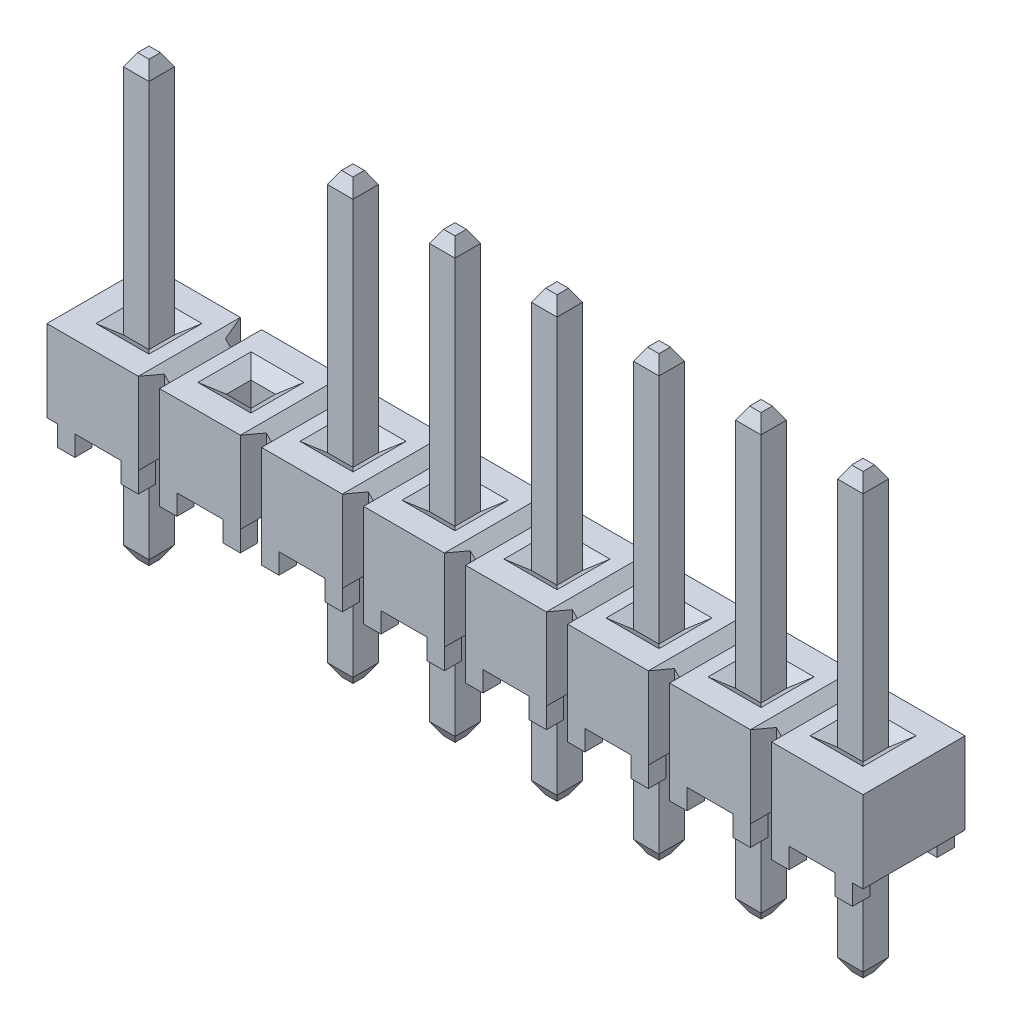
from build123d import *
from OCP.BRepFilletAPI import BRepFilletAPI_MakeChamfer

# Parameters (mm, degrees)
MAIN_BODY_DEPTH                          = 1.27
SKETCH4_W                                = 0.508
SKETCH4_H                                = 1.6764
BASE_CUT_DEPTH                           = 2.54
MAIN_BODY_PATTERN_COUNT                  = 8
MAIN_BODY_PATTERN_PITCH                  = 2.54
SKETCH19_W                               = 0.6096
SKETCH19_H                               = 0.6096
PIN_CUT_DEPTH                            = 19.005357536
PIN_CHAMFER_SIZE                         = 0.254
PIN_CHAMFER_SIZE2                        = 0.3556
PIN_PATTERN_COUNT                        = 8
PIN_PATTERN_PITCH                        = 2.54
PIN_CHAMFER_OF_PIN_PATTERN_SIZE          = 0.254
PIN_CHAMFER_OF_PIN_PATTERN_SIZE2         = 0.3556
SLOT_CUT_1_DEPTH                         = 19.005357536
SLOT_CUT_2_DEPTH                         = 2.54
SLOT_PATTERN_COUNT                       = 7
SLOT_PATTERN_PITCH                       = 2.54
SKETCH9_W                                = 0.635
SKETCH9_H                                = 10.922
STRAIGHT_LEAD_DEPTH                      = 0.3175
LEAD_CHAMFER_SIZE                        = 0.17526
LEAD_CHAMFER_SIZE2                       = 0.3048
STRAIGHT_L_PATTERN_COUNT                 = 8
STRAIGHT_L_PATTERN_PITCH                 = 2.54
LEAD_CHAMFER_OF_STRAIGHT_L_PATTERN_SIZE  = 0.17526
LEAD_CHAMFER_OF_STRAIGHT_L_PATTERN_SIZE2 = 0.3048


with BuildPart() as part:
    # Sketch3 → Main Body (new, symmetric)
    with BuildSketch(Plane.XY):
        Polygon((0, 0.508), (0.26416, 0.508), (0.26416, 0), (0.69596, 0), (0.69596, 0.508), (1.84404, 0.508), (1.84404, 0), (2.27584, 0), (2.27584, 0.508), (2.54, 0.508), (2.54, 2.54), (0, 2.54), align=None)
    main_body = extrude(amount=MAIN_BODY_DEPTH, both=True)

    # Sketch4 → Base Cut (cut)
    with BuildSketch(Plane(origin=(2.54, 2.54, 0), x_dir=(0, -1, 0), z_dir=(-1, 0, 0))):
        with Locations((2.286, 0)):
            Rectangle(SKETCH4_W, SKETCH4_H)
    base_cut = extrude(amount=BASE_CUT_DEPTH, mode=Mode.SUBTRACT)

    # Main Body Pattern: Main Body, Base Cut ×8
    with Locations(*[(-i * MAIN_BODY_PATTERN_PITCH, 0, 0) for i in range(1, MAIN_BODY_PATTERN_COUNT)]):
        add(main_body)
        add(base_cut, mode=Mode.SUBTRACT)

    # Sketch19 → Pin Cut (cut, through all)
    with BuildSketch(Plane(origin=(0, 2.54, 0), x_dir=(-1, 0, 0), z_dir=(0, 1, 0))):
        with Locations((-1.27, 0)):
            Rectangle(SKETCH19_W, SKETCH19_H)
    pin_cut = extrude(amount=-PIN_CUT_DEPTH, mode=Mode.SUBTRACT)

    # Pin Chamfer: one chamfer whose edges measure the first distance from different faces: ONE call of the kernel's chamfer builder (chamfer() names one face for all edges)
    pin_chamfer_edges_1 = [part.edges().sort_by_distance(p)[0] for p in [
        (1.27, 0.508, -0.3048),
        (1.27, 2.54, -0.3048),
    ]]
    pin_chamfer_side_1 = [part.faces().sort_by_distance(p)[0] for p in [
        (1.27, 1.524, -0.3048),
    ]]
    pin_chamfer_edges_2 = [part.edges().sort_by_distance(p)[0] for p in [
        (0.9652, 0.508, 0),
        (0.9652, 2.54, 0),
    ]]
    pin_chamfer_side_2 = [part.faces().sort_by_distance(p)[0] for p in [
        (0.9652, 1.524, 0),
    ]]
    pin_chamfer_edges_3 = [part.edges().sort_by_distance(p)[0] for p in [
        (1.27, 0.508, 0.3048),
        (1.27, 2.54, 0.3048),
    ]]
    pin_chamfer_side_3 = [part.faces().sort_by_distance(p)[0] for p in [
        (1.27, 1.524, 0.3048),
    ]]
    pin_chamfer_edges_4 = [part.edges().sort_by_distance(p)[0] for p in [
        (1.5748, 0.508, 0),
        (1.5748, 2.54, 0),
    ]]
    pin_chamfer_side_4 = [part.faces().sort_by_distance(p)[0] for p in [
        (1.5748, 1.524, 0),
    ]]
    pin_chamfer = BRepFilletAPI_MakeChamfer(part.part.solid().wrapped)
    for e in pin_chamfer_edges_1:
        pin_chamfer.Add(PIN_CHAMFER_SIZE, PIN_CHAMFER_SIZE2, e.wrapped, pin_chamfer_side_1[0].wrapped)  # the first distance lies on this face
    for e in pin_chamfer_edges_2:
        pin_chamfer.Add(PIN_CHAMFER_SIZE, PIN_CHAMFER_SIZE2, e.wrapped, pin_chamfer_side_2[0].wrapped)  # the first distance lies on this face
    for e in pin_chamfer_edges_3:
        pin_chamfer.Add(PIN_CHAMFER_SIZE, PIN_CHAMFER_SIZE2, e.wrapped, pin_chamfer_side_3[0].wrapped)  # the first distance lies on this face
    for e in pin_chamfer_edges_4:
        pin_chamfer.Add(PIN_CHAMFER_SIZE, PIN_CHAMFER_SIZE2, e.wrapped, pin_chamfer_side_4[0].wrapped)  # the first distance lies on this face
    add(Compound.cast(pin_chamfer.Shape()), mode=Mode.REPLACE)

    # Pin Pattern: Pin Cut ×8
    with Locations(*[(-i * PIN_PATTERN_PITCH, 0, 0) for i in range(1, PIN_PATTERN_COUNT)]):
        add(pin_cut, mode=Mode.SUBTRACT)

    # Pin Chamfer of Pin Pattern: one chamfer whose edges measure the first distance from different faces: ONE call of the kernel's chamfer builder (chamfer() names one face for all edges)
    pin_chamfer_of_pin_pattern_edges_1 = [part.edges().sort_by_distance(p)[0] for p in [
        (-1.27, 0.508, -0.3048),
        (-1.27, 2.54, -0.3048),
    ]]
    pin_chamfer_of_pin_pattern_side_1 = [part.faces().sort_by_distance(p)[0] for p in [
        (-1.27, 1.524, -0.3048),
    ]]
    pin_chamfer_of_pin_pattern_edges_2 = [part.edges().sort_by_distance(p)[0] for p in [
        (-1.5748, 0.508, 0),
        (-1.5748, 2.54, 0),
    ]]
    pin_chamfer_of_pin_pattern_side_2 = [part.faces().sort_by_distance(p)[0] for p in [
        (-1.5748, 1.524, 0),
    ]]
    pin_chamfer_of_pin_pattern_edges_3 = [part.edges().sort_by_distance(p)[0] for p in [
        (-1.27, 0.508, 0.3048),
        (-1.27, 2.54, 0.3048),
    ]]
    pin_chamfer_of_pin_pattern_side_3 = [part.faces().sort_by_distance(p)[0] for p in [
        (-1.27, 1.524, 0.3048),
    ]]
    pin_chamfer_of_pin_pattern_edges_4 = [part.edges().sort_by_distance(p)[0] for p in [
        (-0.9652, 0.508, 0),
        (-0.9652, 2.54, 0),
    ]]
    pin_chamfer_of_pin_pattern_side_4 = [part.faces().sort_by_distance(p)[0] for p in [
        (-0.9652, 1.524, 0),
    ]]
    pin_chamfer_of_pin_pattern_edges_5 = [part.edges().sort_by_distance(p)[0] for p in [
        (-3.81, 0.508, -0.3048),
        (-3.81, 2.54, -0.3048),
    ]]
    pin_chamfer_of_pin_pattern_side_5 = [part.faces().sort_by_distance(p)[0] for p in [
        (-3.81, 1.524, -0.3048),
    ]]
    pin_chamfer_of_pin_pattern_edges_6 = [part.edges().sort_by_distance(p)[0] for p in [
        (-4.1148, 0.508, 0),
        (-4.1148, 2.54, 0),
    ]]
    pin_chamfer_of_pin_pattern_side_6 = [part.faces().sort_by_distance(p)[0] for p in [
        (-4.1148, 1.524, 0),
    ]]
    pin_chamfer_of_pin_pattern_edges_7 = [part.edges().sort_by_distance(p)[0] for p in [
        (-3.81, 0.508, 0.3048),
        (-3.81, 2.54, 0.3048),
    ]]
    pin_chamfer_of_pin_pattern_side_7 = [part.faces().sort_by_distance(p)[0] for p in [
        (-3.81, 1.524, 0.3048),
    ]]
    pin_chamfer_of_pin_pattern_edges_8 = [part.edges().sort_by_distance(p)[0] for p in [
        (-3.5052, 0.508, 0),
        (-3.5052, 2.54, 0),
    ]]
    pin_chamfer_of_pin_pattern_side_8 = [part.faces().sort_by_distance(p)[0] for p in [
        (-3.5052, 1.524, 0),
    ]]
    pin_chamfer_of_pin_pattern_edges_9 = [part.edges().sort_by_distance(p)[0] for p in [
        (-6.35, 0.508, -0.3048),
        (-6.35, 2.54, -0.3048),
    ]]
    pin_chamfer_of_pin_pattern_side_9 = [part.faces().sort_by_distance(p)[0] for p in [
        (-6.35, 1.524, -0.3048),
    ]]
    pin_chamfer_of_pin_pattern_edges_10 = [part.edges().sort_by_distance(p)[0] for p in [
        (-6.6548, 0.508, 0),
        (-6.6548, 2.54, 0),
    ]]
    pin_chamfer_of_pin_pattern_side_10 = [part.faces().sort_by_distance(p)[0] for p in [
        (-6.6548, 1.524, 0),
    ]]
    pin_chamfer_of_pin_pattern_edges_11 = [part.edges().sort_by_distance(p)[0] for p in [
        (-6.35, 0.508, 0.3048),
        (-6.35, 2.54, 0.3048),
    ]]
    pin_chamfer_of_pin_pattern_side_11 = [part.faces().sort_by_distance(p)[0] for p in [
        (-6.35, 1.524, 0.3048),
    ]]
    pin_chamfer_of_pin_pattern_edges_12 = [part.edges().sort_by_distance(p)[0] for p in [
        (-6.0452, 0.508, 0),
        (-6.0452, 2.54, 0),
    ]]
    pin_chamfer_of_pin_pattern_side_12 = [part.faces().sort_by_distance(p)[0] for p in [
        (-6.0452, 1.524, 0),
    ]]
    pin_chamfer_of_pin_pattern_edges_13 = [part.edges().sort_by_distance(p)[0] for p in [
        (-8.89, 0.508, -0.3048),
        (-8.89, 2.54, -0.3048),
    ]]
    pin_chamfer_of_pin_pattern_side_13 = [part.faces().sort_by_distance(p)[0] for p in [
        (-8.89, 1.524, -0.3048),
    ]]
    pin_chamfer_of_pin_pattern_edges_14 = [part.edges().sort_by_distance(p)[0] for p in [
        (-9.1948, 0.508, 0),
        (-9.1948, 2.54, 0),
    ]]
    pin_chamfer_of_pin_pattern_side_14 = [part.faces().sort_by_distance(p)[0] for p in [
        (-9.1948, 1.524, 0),
    ]]
    pin_chamfer_of_pin_pattern_edges_15 = [part.edges().sort_by_distance(p)[0] for p in [
        (-8.89, 0.508, 0.3048),
        (-8.89, 2.54, 0.3048),
    ]]
    pin_chamfer_of_pin_pattern_side_15 = [part.faces().sort_by_distance(p)[0] for p in [
        (-8.89, 1.524, 0.3048),
    ]]
    pin_chamfer_of_pin_pattern_edges_16 = [part.edges().sort_by_distance(p)[0] for p in [
        (-8.5852, 0.508, 0),
        (-8.5852, 2.54, 0),
    ]]
    pin_chamfer_of_pin_pattern_side_16 = [part.faces().sort_by_distance(p)[0] for p in [
        (-8.5852, 1.524, 0),
    ]]
    pin_chamfer_of_pin_pattern_edges_17 = [part.edges().sort_by_distance(p)[0] for p in [
        (-11.43, 0.508, -0.3048),
        (-11.43, 2.54, -0.3048),
    ]]
    pin_chamfer_of_pin_pattern_side_17 = [part.faces().sort_by_distance(p)[0] for p in [
        (-11.43, 1.524, -0.3048),
    ]]
    pin_chamfer_of_pin_pattern_edges_18 = [part.edges().sort_by_distance(p)[0] for p in [
        (-11.7348, 0.508, 0),
        (-11.7348, 2.54, 0),
    ]]
    pin_chamfer_of_pin_pattern_side_18 = [part.faces().sort_by_distance(p)[0] for p in [
        (-11.7348, 1.524, 0),
    ]]
    pin_chamfer_of_pin_pattern_edges_19 = [part.edges().sort_by_distance(p)[0] for p in [
        (-11.43, 0.508, 0.3048),
        (-11.43, 2.54, 0.3048),
    ]]
    pin_chamfer_of_pin_pattern_side_19 = [part.faces().sort_by_distance(p)[0] for p in [
        (-11.43, 1.524, 0.3048),
    ]]
    pin_chamfer_of_pin_pattern_edges_20 = [part.edges().sort_by_distance(p)[0] for p in [
        (-11.1252, 0.508, 0),
        (-11.1252, 2.54, 0),
    ]]
    pin_chamfer_of_pin_pattern_side_20 = [part.faces().sort_by_distance(p)[0] for p in [
        (-11.1252, 1.524, 0),
    ]]
    pin_chamfer_of_pin_pattern_edges_21 = [part.edges().sort_by_distance(p)[0] for p in [
        (-13.97, 0.508, -0.3048),
        (-13.97, 2.54, -0.3048),
    ]]
    pin_chamfer_of_pin_pattern_side_21 = [part.faces().sort_by_distance(p)[0] for p in [
        (-13.97, 1.524, -0.3048),
    ]]
    pin_chamfer_of_pin_pattern_edges_22 = [part.edges().sort_by_distance(p)[0] for p in [
        (-14.2748, 0.508, 0),
        (-14.2748, 2.54, 0),
    ]]
    pin_chamfer_of_pin_pattern_side_22 = [part.faces().sort_by_distance(p)[0] for p in [
        (-14.2748, 1.524, 0),
    ]]
    pin_chamfer_of_pin_pattern_edges_23 = [part.edges().sort_by_distance(p)[0] for p in [
        (-13.97, 0.508, 0.3048),
        (-13.97, 2.54, 0.3048),
    ]]
    pin_chamfer_of_pin_pattern_side_23 = [part.faces().sort_by_distance(p)[0] for p in [
        (-13.97, 1.524, 0.3048),
    ]]
    pin_chamfer_of_pin_pattern_edges_24 = [part.edges().sort_by_distance(p)[0] for p in [
        (-13.6652, 0.508, 0),
        (-13.6652, 2.54, 0),
    ]]
    pin_chamfer_of_pin_pattern_side_24 = [part.faces().sort_by_distance(p)[0] for p in [
        (-13.6652, 1.524, 0),
    ]]
    pin_chamfer_of_pin_pattern_edges_25 = [part.edges().sort_by_distance(p)[0] for p in [
        (-16.51, 0.508, -0.3048),
        (-16.51, 2.54, -0.3048),
    ]]
    pin_chamfer_of_pin_pattern_side_25 = [part.faces().sort_by_distance(p)[0] for p in [
        (-16.51, 1.524, -0.3048),
    ]]
    pin_chamfer_of_pin_pattern_edges_26 = [part.edges().sort_by_distance(p)[0] for p in [
        (-16.8148, 0.508, 0),
        (-16.8148, 2.54, 0),
    ]]
    pin_chamfer_of_pin_pattern_side_26 = [part.faces().sort_by_distance(p)[0] for p in [
        (-16.8148, 1.524, 0),
    ]]
    pin_chamfer_of_pin_pattern_edges_27 = [part.edges().sort_by_distance(p)[0] for p in [
        (-16.51, 0.508, 0.3048),
        (-16.51, 2.54, 0.3048),
    ]]
    pin_chamfer_of_pin_pattern_side_27 = [part.faces().sort_by_distance(p)[0] for p in [
        (-16.51, 1.524, 0.3048),
    ]]
    pin_chamfer_of_pin_pattern_edges_28 = [part.edges().sort_by_distance(p)[0] for p in [
        (-16.2052, 0.508, 0),
        (-16.2052, 2.54, 0),
    ]]
    pin_chamfer_of_pin_pattern_side_28 = [part.faces().sort_by_distance(p)[0] for p in [
        (-16.2052, 1.524, 0),
    ]]
    pin_chamfer_of_pin_pattern = BRepFilletAPI_MakeChamfer(part.part.solid().wrapped)
    for e in pin_chamfer_of_pin_pattern_edges_1:
        pin_chamfer_of_pin_pattern.Add(PIN_CHAMFER_OF_PIN_PATTERN_SIZE, PIN_CHAMFER_OF_PIN_PATTERN_SIZE2, e.wrapped, pin_chamfer_of_pin_pattern_side_1[0].wrapped)  # the first distance lies on this face
    for e in pin_chamfer_of_pin_pattern_edges_2:
        pin_chamfer_of_pin_pattern.Add(PIN_CHAMFER_OF_PIN_PATTERN_SIZE, PIN_CHAMFER_OF_PIN_PATTERN_SIZE2, e.wrapped, pin_chamfer_of_pin_pattern_side_2[0].wrapped)  # the first distance lies on this face
    for e in pin_chamfer_of_pin_pattern_edges_3:
        pin_chamfer_of_pin_pattern.Add(PIN_CHAMFER_OF_PIN_PATTERN_SIZE, PIN_CHAMFER_OF_PIN_PATTERN_SIZE2, e.wrapped, pin_chamfer_of_pin_pattern_side_3[0].wrapped)  # the first distance lies on this face
    for e in pin_chamfer_of_pin_pattern_edges_4:
        pin_chamfer_of_pin_pattern.Add(PIN_CHAMFER_OF_PIN_PATTERN_SIZE, PIN_CHAMFER_OF_PIN_PATTERN_SIZE2, e.wrapped, pin_chamfer_of_pin_pattern_side_4[0].wrapped)  # the first distance lies on this face
    for e in pin_chamfer_of_pin_pattern_edges_5:
        pin_chamfer_of_pin_pattern.Add(PIN_CHAMFER_OF_PIN_PATTERN_SIZE, PIN_CHAMFER_OF_PIN_PATTERN_SIZE2, e.wrapped, pin_chamfer_of_pin_pattern_side_5[0].wrapped)  # the first distance lies on this face
    for e in pin_chamfer_of_pin_pattern_edges_6:
        pin_chamfer_of_pin_pattern.Add(PIN_CHAMFER_OF_PIN_PATTERN_SIZE, PIN_CHAMFER_OF_PIN_PATTERN_SIZE2, e.wrapped, pin_chamfer_of_pin_pattern_side_6[0].wrapped)  # the first distance lies on this face
    for e in pin_chamfer_of_pin_pattern_edges_7:
        pin_chamfer_of_pin_pattern.Add(PIN_CHAMFER_OF_PIN_PATTERN_SIZE, PIN_CHAMFER_OF_PIN_PATTERN_SIZE2, e.wrapped, pin_chamfer_of_pin_pattern_side_7[0].wrapped)  # the first distance lies on this face
    for e in pin_chamfer_of_pin_pattern_edges_8:
        pin_chamfer_of_pin_pattern.Add(PIN_CHAMFER_OF_PIN_PATTERN_SIZE, PIN_CHAMFER_OF_PIN_PATTERN_SIZE2, e.wrapped, pin_chamfer_of_pin_pattern_side_8[0].wrapped)  # the first distance lies on this face
    for e in pin_chamfer_of_pin_pattern_edges_9:
        pin_chamfer_of_pin_pattern.Add(PIN_CHAMFER_OF_PIN_PATTERN_SIZE, PIN_CHAMFER_OF_PIN_PATTERN_SIZE2, e.wrapped, pin_chamfer_of_pin_pattern_side_9[0].wrapped)  # the first distance lies on this face
    for e in pin_chamfer_of_pin_pattern_edges_10:
        pin_chamfer_of_pin_pattern.Add(PIN_CHAMFER_OF_PIN_PATTERN_SIZE, PIN_CHAMFER_OF_PIN_PATTERN_SIZE2, e.wrapped, pin_chamfer_of_pin_pattern_side_10[0].wrapped)  # the first distance lies on this face
    for e in pin_chamfer_of_pin_pattern_edges_11:
        pin_chamfer_of_pin_pattern.Add(PIN_CHAMFER_OF_PIN_PATTERN_SIZE, PIN_CHAMFER_OF_PIN_PATTERN_SIZE2, e.wrapped, pin_chamfer_of_pin_pattern_side_11[0].wrapped)  # the first distance lies on this face
    for e in pin_chamfer_of_pin_pattern_edges_12:
        pin_chamfer_of_pin_pattern.Add(PIN_CHAMFER_OF_PIN_PATTERN_SIZE, PIN_CHAMFER_OF_PIN_PATTERN_SIZE2, e.wrapped, pin_chamfer_of_pin_pattern_side_12[0].wrapped)  # the first distance lies on this face
    for e in pin_chamfer_of_pin_pattern_edges_13:
        pin_chamfer_of_pin_pattern.Add(PIN_CHAMFER_OF_PIN_PATTERN_SIZE, PIN_CHAMFER_OF_PIN_PATTERN_SIZE2, e.wrapped, pin_chamfer_of_pin_pattern_side_13[0].wrapped)  # the first distance lies on this face
    for e in pin_chamfer_of_pin_pattern_edges_14:
        pin_chamfer_of_pin_pattern.Add(PIN_CHAMFER_OF_PIN_PATTERN_SIZE, PIN_CHAMFER_OF_PIN_PATTERN_SIZE2, e.wrapped, pin_chamfer_of_pin_pattern_side_14[0].wrapped)  # the first distance lies on this face
    for e in pin_chamfer_of_pin_pattern_edges_15:
        pin_chamfer_of_pin_pattern.Add(PIN_CHAMFER_OF_PIN_PATTERN_SIZE, PIN_CHAMFER_OF_PIN_PATTERN_SIZE2, e.wrapped, pin_chamfer_of_pin_pattern_side_15[0].wrapped)  # the first distance lies on this face
    for e in pin_chamfer_of_pin_pattern_edges_16:
        pin_chamfer_of_pin_pattern.Add(PIN_CHAMFER_OF_PIN_PATTERN_SIZE, PIN_CHAMFER_OF_PIN_PATTERN_SIZE2, e.wrapped, pin_chamfer_of_pin_pattern_side_16[0].wrapped)  # the first distance lies on this face
    for e in pin_chamfer_of_pin_pattern_edges_17:
        pin_chamfer_of_pin_pattern.Add(PIN_CHAMFER_OF_PIN_PATTERN_SIZE, PIN_CHAMFER_OF_PIN_PATTERN_SIZE2, e.wrapped, pin_chamfer_of_pin_pattern_side_17[0].wrapped)  # the first distance lies on this face
    for e in pin_chamfer_of_pin_pattern_edges_18:
        pin_chamfer_of_pin_pattern.Add(PIN_CHAMFER_OF_PIN_PATTERN_SIZE, PIN_CHAMFER_OF_PIN_PATTERN_SIZE2, e.wrapped, pin_chamfer_of_pin_pattern_side_18[0].wrapped)  # the first distance lies on this face
    for e in pin_chamfer_of_pin_pattern_edges_19:
        pin_chamfer_of_pin_pattern.Add(PIN_CHAMFER_OF_PIN_PATTERN_SIZE, PIN_CHAMFER_OF_PIN_PATTERN_SIZE2, e.wrapped, pin_chamfer_of_pin_pattern_side_19[0].wrapped)  # the first distance lies on this face
    for e in pin_chamfer_of_pin_pattern_edges_20:
        pin_chamfer_of_pin_pattern.Add(PIN_CHAMFER_OF_PIN_PATTERN_SIZE, PIN_CHAMFER_OF_PIN_PATTERN_SIZE2, e.wrapped, pin_chamfer_of_pin_pattern_side_20[0].wrapped)  # the first distance lies on this face
    for e in pin_chamfer_of_pin_pattern_edges_21:
        pin_chamfer_of_pin_pattern.Add(PIN_CHAMFER_OF_PIN_PATTERN_SIZE, PIN_CHAMFER_OF_PIN_PATTERN_SIZE2, e.wrapped, pin_chamfer_of_pin_pattern_side_21[0].wrapped)  # the first distance lies on this face
    for e in pin_chamfer_of_pin_pattern_edges_22:
        pin_chamfer_of_pin_pattern.Add(PIN_CHAMFER_OF_PIN_PATTERN_SIZE, PIN_CHAMFER_OF_PIN_PATTERN_SIZE2, e.wrapped, pin_chamfer_of_pin_pattern_side_22[0].wrapped)  # the first distance lies on this face
    for e in pin_chamfer_of_pin_pattern_edges_23:
        pin_chamfer_of_pin_pattern.Add(PIN_CHAMFER_OF_PIN_PATTERN_SIZE, PIN_CHAMFER_OF_PIN_PATTERN_SIZE2, e.wrapped, pin_chamfer_of_pin_pattern_side_23[0].wrapped)  # the first distance lies on this face
    for e in pin_chamfer_of_pin_pattern_edges_24:
        pin_chamfer_of_pin_pattern.Add(PIN_CHAMFER_OF_PIN_PATTERN_SIZE, PIN_CHAMFER_OF_PIN_PATTERN_SIZE2, e.wrapped, pin_chamfer_of_pin_pattern_side_24[0].wrapped)  # the first distance lies on this face
    for e in pin_chamfer_of_pin_pattern_edges_25:
        pin_chamfer_of_pin_pattern.Add(PIN_CHAMFER_OF_PIN_PATTERN_SIZE, PIN_CHAMFER_OF_PIN_PATTERN_SIZE2, e.wrapped, pin_chamfer_of_pin_pattern_side_25[0].wrapped)  # the first distance lies on this face
    for e in pin_chamfer_of_pin_pattern_edges_26:
        pin_chamfer_of_pin_pattern.Add(PIN_CHAMFER_OF_PIN_PATTERN_SIZE, PIN_CHAMFER_OF_PIN_PATTERN_SIZE2, e.wrapped, pin_chamfer_of_pin_pattern_side_26[0].wrapped)  # the first distance lies on this face
    for e in pin_chamfer_of_pin_pattern_edges_27:
        pin_chamfer_of_pin_pattern.Add(PIN_CHAMFER_OF_PIN_PATTERN_SIZE, PIN_CHAMFER_OF_PIN_PATTERN_SIZE2, e.wrapped, pin_chamfer_of_pin_pattern_side_27[0].wrapped)  # the first distance lies on this face
    for e in pin_chamfer_of_pin_pattern_edges_28:
        pin_chamfer_of_pin_pattern.Add(PIN_CHAMFER_OF_PIN_PATTERN_SIZE, PIN_CHAMFER_OF_PIN_PATTERN_SIZE2, e.wrapped, pin_chamfer_of_pin_pattern_side_28[0].wrapped)  # the first distance lies on this face
    add(Compound.cast(pin_chamfer_of_pin_pattern.Shape()), mode=Mode.REPLACE)

    # Sketch5 → Slot Cut-1 (cut, through all)
    with BuildSketch(Plane(origin=(0, 0, 0), x_dir=(1, 0, 0), z_dir=(0, 1, 0))):
        Polygon((-0.26416, 1.27), (0.26416, 1.27), (0.127, 0.762), (-0.127, 0.762), align=None)
        Polygon((-0.127, -0.762), (-0.26416, -1.27), (0.26416, -1.27), (0.127, -0.762), align=None)
    slot_cut_1 = extrude(amount=SLOT_CUT_1_DEPTH, mode=Mode.SUBTRACT)

    # Sketch7 → Slot Cut-2 (cut)
    with BuildSketch(Plane.XY.offset(1.27)):
        Polygon((-0.26416, 2.54), (0, 2.27584), (0.26416, 2.54), align=None)
        Polygon((0.26416, 0.508), (-0.26416, 0.508), (0, 0.77216), align=None)
    slot_cut_2 = extrude(amount=-SLOT_CUT_2_DEPTH, mode=Mode.SUBTRACT)

    # Slot Pattern: Slot Cut-1, Slot Cut-2 ×7
    with Locations(*[(-i * SLOT_PATTERN_PITCH, 0, 0) for i in range(1, SLOT_PATTERN_COUNT)]):
        add(slot_cut_1, mode=Mode.SUBTRACT)
        add(slot_cut_2, mode=Mode.SUBTRACT)

    # Sketch9 → Straight Lead (add, symmetric)
    with BuildSketch(Plane(origin=(1.27, 0, 0), x_dir=(0, 0, -1), z_dir=(1, 0, 0))):
        with Locations((0, 2.921)):
            Rectangle(SKETCH9_W, SKETCH9_H)
    straight_lead = extrude(amount=STRAIGHT_LEAD_DEPTH, both=True)

    # Lead Chamfer: one chamfer whose edges measure the first distance from different faces: ONE call of the kernel's chamfer builder (chamfer() names one face for all edges)
    lead_chamfer_edges_1 = [part.edges().sort_by_distance(p)[0] for p in [
        (1.5875, -2.54, 0),
        (1.27, -2.54, -0.3175),
        (0.9525, -2.54, 0),
        (1.27, -2.54, 0.3175),
    ]]
    lead_chamfer_side_1 = [part.faces().sort_by_distance(p)[0] for p in [
        (1.27, -2.54, 0),
    ]]
    lead_chamfer_edges_2 = [part.edges().sort_by_distance(p)[0] for p in [
        (1.27, 8.382, 0.3175),
        (0.9525, 8.382, 0),
        (1.27, 8.382, -0.3175),
        (1.5875, 8.382, 0),
    ]]
    lead_chamfer_side_2 = [part.faces().sort_by_distance(p)[0] for p in [
        (1.27, 8.382, 0),
    ]]
    lead_chamfer = BRepFilletAPI_MakeChamfer(part.part.solid().wrapped)
    for e in lead_chamfer_edges_1:
        lead_chamfer.Add(LEAD_CHAMFER_SIZE, LEAD_CHAMFER_SIZE2, e.wrapped, lead_chamfer_side_1[0].wrapped)  # the first distance lies on this face
    for e in lead_chamfer_edges_2:
        lead_chamfer.Add(LEAD_CHAMFER_SIZE, LEAD_CHAMFER_SIZE2, e.wrapped, lead_chamfer_side_2[0].wrapped)  # the first distance lies on this face
    add(Compound.cast(lead_chamfer.Shape()), mode=Mode.REPLACE)

    # Straight L Pattern: Straight Lead ×8, 1 skipped
    with Locations(*[(-i * STRAIGHT_L_PATTERN_PITCH, 0, 0) for i in range(1, STRAIGHT_L_PATTERN_COUNT) if i not in (6,)]):
        add(straight_lead)

    # Lead Chamfer of Straight L Pattern: one chamfer whose edges measure the first distance from different faces: ONE call of the kernel's chamfer builder (chamfer() names one face for all edges)
    lead_chamfer_of_straight_l_pattern_edges_1 = [part.edges().sort_by_distance(p)[0] for p in [
        (-0.9525, -2.54, 0),
        (-1.27, -2.54, -0.3175),
        (-1.5875, -2.54, 0),
        (-1.27, -2.54, 0.3175),
    ]]
    lead_chamfer_of_straight_l_pattern_side_1 = [part.faces().sort_by_distance(p)[0] for p in [
        (-1.27, -2.54, 0),
    ]]
    lead_chamfer_of_straight_l_pattern_edges_2 = [part.edges().sort_by_distance(p)[0] for p in [
        (-1.27, 8.382, 0.3175),
        (-1.5875, 8.382, 0),
        (-1.27, 8.382, -0.3175),
        (-0.9525, 8.382, 0),
    ]]
    lead_chamfer_of_straight_l_pattern_side_2 = [part.faces().sort_by_distance(p)[0] for p in [
        (-1.27, 8.382, 0),
    ]]
    lead_chamfer_of_straight_l_pattern_edges_3 = [part.edges().sort_by_distance(p)[0] for p in [
        (-3.4925, -2.54, 0),
        (-3.81, -2.54, -0.3175),
        (-4.1275, -2.54, 0),
        (-3.81, -2.54, 0.3175),
    ]]
    lead_chamfer_of_straight_l_pattern_side_3 = [part.faces().sort_by_distance(p)[0] for p in [
        (-3.81, -2.54, 0),
    ]]
    lead_chamfer_of_straight_l_pattern_edges_4 = [part.edges().sort_by_distance(p)[0] for p in [
        (-3.81, 8.382, 0.3175),
        (-4.1275, 8.382, 0),
        (-3.81, 8.382, -0.3175),
        (-3.4925, 8.382, 0),
    ]]
    lead_chamfer_of_straight_l_pattern_side_4 = [part.faces().sort_by_distance(p)[0] for p in [
        (-3.81, 8.382, 0),
    ]]
    lead_chamfer_of_straight_l_pattern_edges_5 = [part.edges().sort_by_distance(p)[0] for p in [
        (-6.0325, -2.54, 0),
        (-6.35, -2.54, -0.3175),
        (-6.6675, -2.54, 0),
        (-6.35, -2.54, 0.3175),
    ]]
    lead_chamfer_of_straight_l_pattern_side_5 = [part.faces().sort_by_distance(p)[0] for p in [
        (-6.35, -2.54, 0),
    ]]
    lead_chamfer_of_straight_l_pattern_edges_6 = [part.edges().sort_by_distance(p)[0] for p in [
        (-6.35, 8.382, 0.3175),
        (-6.6675, 8.382, 0),
        (-6.35, 8.382, -0.3175),
        (-6.0325, 8.382, 0),
    ]]
    lead_chamfer_of_straight_l_pattern_side_6 = [part.faces().sort_by_distance(p)[0] for p in [
        (-6.35, 8.382, 0),
    ]]
    lead_chamfer_of_straight_l_pattern_edges_7 = [part.edges().sort_by_distance(p)[0] for p in [
        (-8.5725, -2.54, 0),
        (-8.89, -2.54, -0.3175),
        (-9.2075, -2.54, 0),
        (-8.89, -2.54, 0.3175),
    ]]
    lead_chamfer_of_straight_l_pattern_side_7 = [part.faces().sort_by_distance(p)[0] for p in [
        (-8.89, -2.54, 0),
    ]]
    lead_chamfer_of_straight_l_pattern_edges_8 = [part.edges().sort_by_distance(p)[0] for p in [
        (-8.89, 8.382, 0.3175),
        (-9.2075, 8.382, 0),
        (-8.89, 8.382, -0.3175),
        (-8.5725, 8.382, 0),
    ]]
    lead_chamfer_of_straight_l_pattern_side_8 = [part.faces().sort_by_distance(p)[0] for p in [
        (-8.89, 8.382, 0),
    ]]
    lead_chamfer_of_straight_l_pattern_edges_9 = [part.edges().sort_by_distance(p)[0] for p in [
        (-11.1125, -2.54, 0),
        (-11.43, -2.54, -0.3175),
        (-11.7475, -2.54, 0),
        (-11.43, -2.54, 0.3175),
    ]]
    lead_chamfer_of_straight_l_pattern_side_9 = [part.faces().sort_by_distance(p)[0] for p in [
        (-11.43, -2.54, 0),
    ]]
    lead_chamfer_of_straight_l_pattern_edges_10 = [part.edges().sort_by_distance(p)[0] for p in [
        (-11.43, 8.382, 0.3175),
        (-11.7475, 8.382, 0),
        (-11.43, 8.382, -0.3175),
        (-11.1125, 8.382, 0),
    ]]
    lead_chamfer_of_straight_l_pattern_side_10 = [part.faces().sort_by_distance(p)[0] for p in [
        (-11.43, 8.382, 0),
    ]]
    lead_chamfer_of_straight_l_pattern_edges_11 = [part.edges().sort_by_distance(p)[0] for p in [
        (-16.1925, -2.54, 0),
        (-16.51, -2.54, -0.3175),
        (-16.8275, -2.54, 0),
        (-16.51, -2.54, 0.3175),
    ]]
    lead_chamfer_of_straight_l_pattern_side_11 = [part.faces().sort_by_distance(p)[0] for p in [
        (-16.51, -2.54, 0),
    ]]
    lead_chamfer_of_straight_l_pattern_edges_12 = [part.edges().sort_by_distance(p)[0] for p in [
        (-16.51, 8.382, 0.3175),
        (-16.8275, 8.382, 0),
        (-16.51, 8.382, -0.3175),
        (-16.1925, 8.382, 0),
    ]]
    lead_chamfer_of_straight_l_pattern_side_12 = [part.faces().sort_by_distance(p)[0] for p in [
        (-16.51, 8.382, 0),
    ]]
    lead_chamfer_of_straight_l_pattern = BRepFilletAPI_MakeChamfer(part.part.solid().wrapped)
    for e in lead_chamfer_of_straight_l_pattern_edges_1:
        lead_chamfer_of_straight_l_pattern.Add(LEAD_CHAMFER_OF_STRAIGHT_L_PATTERN_SIZE, LEAD_CHAMFER_OF_STRAIGHT_L_PATTERN_SIZE2, e.wrapped, lead_chamfer_of_straight_l_pattern_side_1[0].wrapped)  # the first distance lies on this face
    for e in lead_chamfer_of_straight_l_pattern_edges_2:
        lead_chamfer_of_straight_l_pattern.Add(LEAD_CHAMFER_OF_STRAIGHT_L_PATTERN_SIZE, LEAD_CHAMFER_OF_STRAIGHT_L_PATTERN_SIZE2, e.wrapped, lead_chamfer_of_straight_l_pattern_side_2[0].wrapped)  # the first distance lies on this face
    for e in lead_chamfer_of_straight_l_pattern_edges_3:
        lead_chamfer_of_straight_l_pattern.Add(LEAD_CHAMFER_OF_STRAIGHT_L_PATTERN_SIZE, LEAD_CHAMFER_OF_STRAIGHT_L_PATTERN_SIZE2, e.wrapped, lead_chamfer_of_straight_l_pattern_side_3[0].wrapped)  # the first distance lies on this face
    for e in lead_chamfer_of_straight_l_pattern_edges_4:
        lead_chamfer_of_straight_l_pattern.Add(LEAD_CHAMFER_OF_STRAIGHT_L_PATTERN_SIZE, LEAD_CHAMFER_OF_STRAIGHT_L_PATTERN_SIZE2, e.wrapped, lead_chamfer_of_straight_l_pattern_side_4[0].wrapped)  # the first distance lies on this face
    for e in lead_chamfer_of_straight_l_pattern_edges_5:
        lead_chamfer_of_straight_l_pattern.Add(LEAD_CHAMFER_OF_STRAIGHT_L_PATTERN_SIZE, LEAD_CHAMFER_OF_STRAIGHT_L_PATTERN_SIZE2, e.wrapped, lead_chamfer_of_straight_l_pattern_side_5[0].wrapped)  # the first distance lies on this face
    for e in lead_chamfer_of_straight_l_pattern_edges_6:
        lead_chamfer_of_straight_l_pattern.Add(LEAD_CHAMFER_OF_STRAIGHT_L_PATTERN_SIZE, LEAD_CHAMFER_OF_STRAIGHT_L_PATTERN_SIZE2, e.wrapped, lead_chamfer_of_straight_l_pattern_side_6[0].wrapped)  # the first distance lies on this face
    for e in lead_chamfer_of_straight_l_pattern_edges_7:
        lead_chamfer_of_straight_l_pattern.Add(LEAD_CHAMFER_OF_STRAIGHT_L_PATTERN_SIZE, LEAD_CHAMFER_OF_STRAIGHT_L_PATTERN_SIZE2, e.wrapped, lead_chamfer_of_straight_l_pattern_side_7[0].wrapped)  # the first distance lies on this face
    for e in lead_chamfer_of_straight_l_pattern_edges_8:
        lead_chamfer_of_straight_l_pattern.Add(LEAD_CHAMFER_OF_STRAIGHT_L_PATTERN_SIZE, LEAD_CHAMFER_OF_STRAIGHT_L_PATTERN_SIZE2, e.wrapped, lead_chamfer_of_straight_l_pattern_side_8[0].wrapped)  # the first distance lies on this face
    for e in lead_chamfer_of_straight_l_pattern_edges_9:
        lead_chamfer_of_straight_l_pattern.Add(LEAD_CHAMFER_OF_STRAIGHT_L_PATTERN_SIZE, LEAD_CHAMFER_OF_STRAIGHT_L_PATTERN_SIZE2, e.wrapped, lead_chamfer_of_straight_l_pattern_side_9[0].wrapped)  # the first distance lies on this face
    for e in lead_chamfer_of_straight_l_pattern_edges_10:
        lead_chamfer_of_straight_l_pattern.Add(LEAD_CHAMFER_OF_STRAIGHT_L_PATTERN_SIZE, LEAD_CHAMFER_OF_STRAIGHT_L_PATTERN_SIZE2, e.wrapped, lead_chamfer_of_straight_l_pattern_side_10[0].wrapped)  # the first distance lies on this face
    for e in lead_chamfer_of_straight_l_pattern_edges_11:
        lead_chamfer_of_straight_l_pattern.Add(LEAD_CHAMFER_OF_STRAIGHT_L_PATTERN_SIZE, LEAD_CHAMFER_OF_STRAIGHT_L_PATTERN_SIZE2, e.wrapped, lead_chamfer_of_straight_l_pattern_side_11[0].wrapped)  # the first distance lies on this face
    for e in lead_chamfer_of_straight_l_pattern_edges_12:
        lead_chamfer_of_straight_l_pattern.Add(LEAD_CHAMFER_OF_STRAIGHT_L_PATTERN_SIZE, LEAD_CHAMFER_OF_STRAIGHT_L_PATTERN_SIZE2, e.wrapped, lead_chamfer_of_straight_l_pattern_side_12[0].wrapped)  # the first distance lies on this face
    add(Compound.cast(lead_chamfer_of_straight_l_pattern.Shape()), mode=Mode.REPLACE)


solid = part.part
